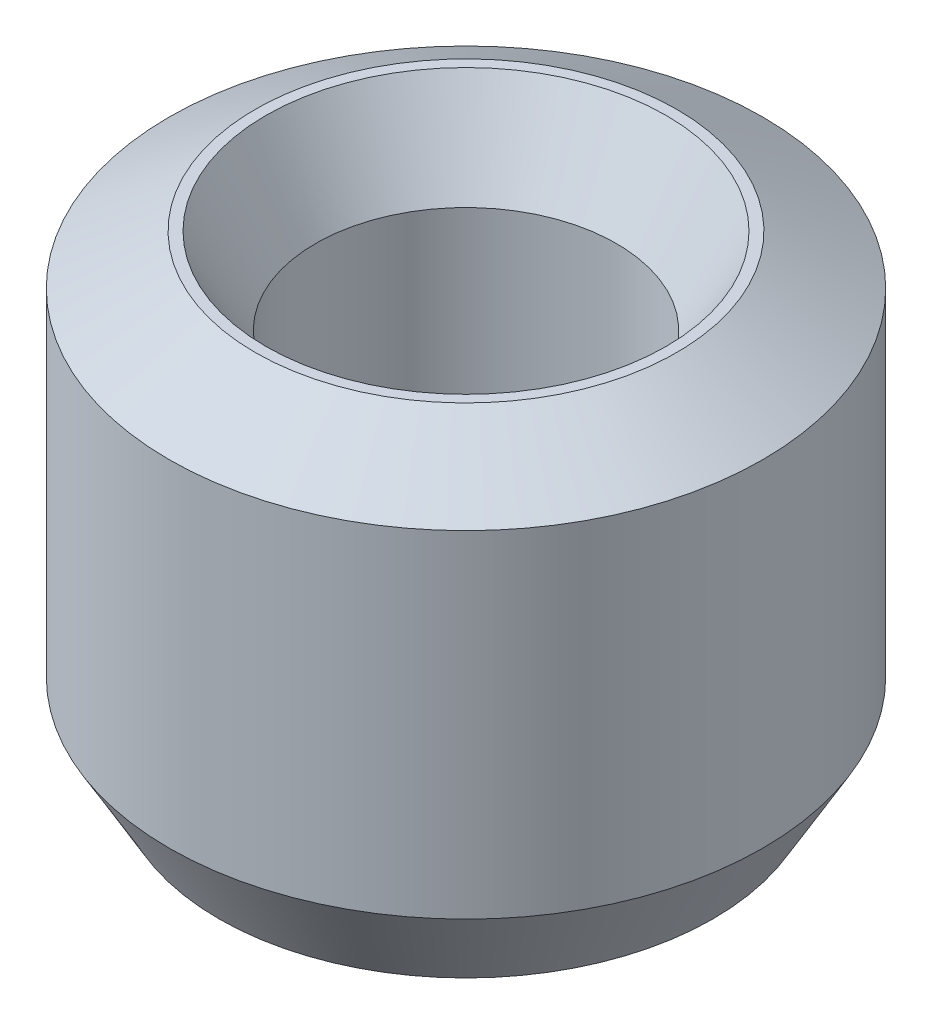
from build123d import *
from OCP.BRepFilletAPI import BRepFilletAPI_MakeChamfer

# Parameters (mm, degrees)
SKETCH1_R           = 20
BOSS_EXTRUDE1_DEPTH = 31.825254921
SKETCH2_R           = 10.136571739
CUT_EXTRUDE1_DEPTH  = 43.577539276
CHAMFER1_SIZE       = 3.349491569
CHAMFER1_SIZE2      = 5.801489577


with BuildPart() as part:
    # Sketch1 → Boss-Extrude1 (new body)
    with BuildSketch(Plane(origin=(0, 0, 0), x_dir=(1, 0, 0), z_dir=(0, 1, 0))):
        Circle(SKETCH1_R)
    extrude(amount=BOSS_EXTRUDE1_DEPTH)

    # Sketch2 → Cut-Extrude1 (cut, through all)
    with BuildSketch(Plane(origin=(0, 0, 0), x_dir=(1, 0, 0), z_dir=(0, 1, 0))):
        Circle(SKETCH2_R)
    extrude(amount=CUT_EXTRUDE1_DEPTH, mode=Mode.SUBTRACT)

    # Chamfer1: one chamfer whose edges measure the first distance from different faces: ONE call of the kernel's chamfer builder (chamfer() names one face for all edges)
    chamfer1_edges_1 = [part.edges().sort_by_distance(p)[0] for p in [
        (-10.136571739, 31.825254921, 0),
    ]]
    chamfer1_side_1 = [part.faces().sort_by_distance(p)[0] for p in [
        (-19.434314575, 31.825254921, 0),
    ]]
    chamfer1_edges_2 = [part.edges().sort_by_distance(p)[0] for p in [
        (-10.136571739, 0, 0),
    ]]
    chamfer1_side_2 = [part.faces().sort_by_distance(p)[0] for p in [
        (-10.136571739, 15.912627461, 0),
    ]]
    chamfer1_edges_3 = [part.edges().sort_by_distance(p)[0] for p in [
        (-20, 0, 0),
    ]]
    chamfer1_side_3 = [part.faces().sort_by_distance(p)[0] for p in [
        (-19.434314575, 0, 0),
    ]]
    chamfer1_edges_4 = [part.edges().sort_by_distance(p)[0] for p in [
        (-20, 31.825254921, 0),
    ]]
    chamfer1_side_4 = [part.faces().sort_by_distance(p)[0] for p in [
        (-20, 15.912627461, 0),
    ]]
    chamfer1 = BRepFilletAPI_MakeChamfer(part.part.solid().wrapped)
    for e in chamfer1_edges_1:
        chamfer1.Add(CHAMFER1_SIZE, CHAMFER1_SIZE2, e.wrapped, chamfer1_side_1[0].wrapped)  # the first distance lies on this face
    for e in chamfer1_edges_2:
        chamfer1.Add(CHAMFER1_SIZE, CHAMFER1_SIZE2, e.wrapped, chamfer1_side_2[0].wrapped)  # the first distance lies on this face
    for e in chamfer1_edges_3:
        chamfer1.Add(CHAMFER1_SIZE, CHAMFER1_SIZE2, e.wrapped, chamfer1_side_3[0].wrapped)  # the first distance lies on this face
    for e in chamfer1_edges_4:
        chamfer1.Add(CHAMFER1_SIZE, CHAMFER1_SIZE2, e.wrapped, chamfer1_side_4[0].wrapped)  # the first distance lies on this face
    add(Compound.cast(chamfer1.Shape()), mode=Mode.REPLACE)


solid = part.part
